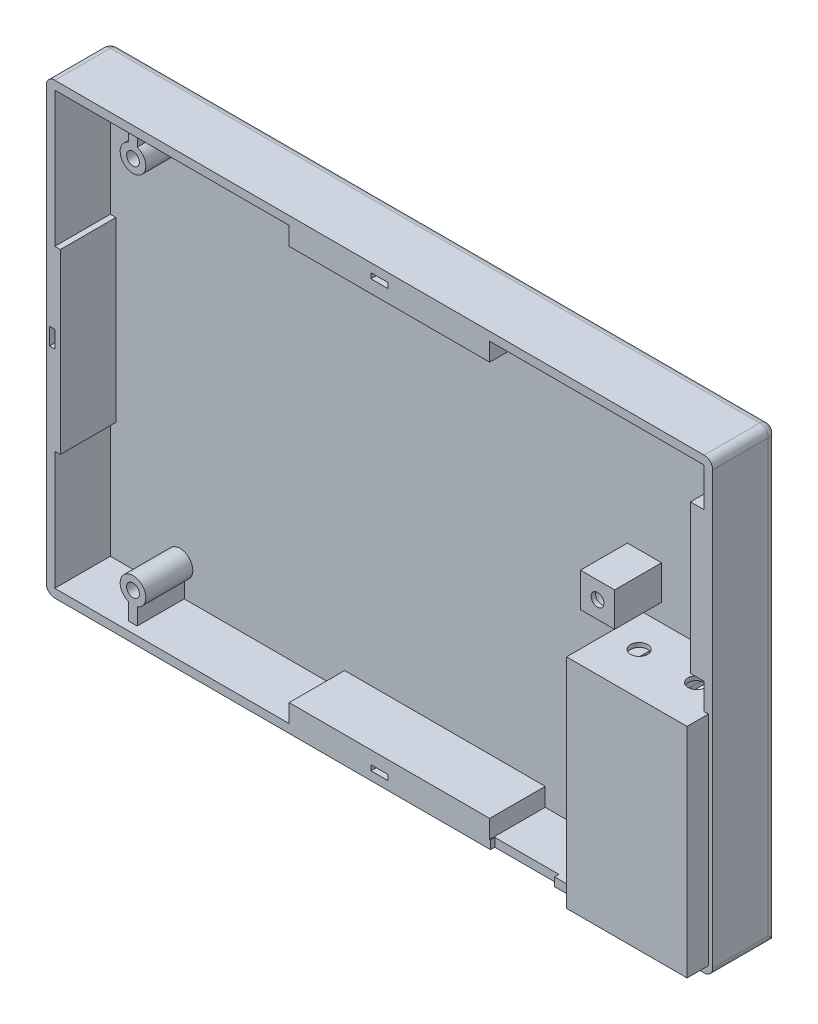
from build123d import *

# Parameters (mm, degrees)
SKETCH2_W                = 156
SKETCH2_H                = 105
BOSS_EXTRUDE1_DEPTH      = 15
SHELL1_T                 = -2
SKETCH16_W               = 1.3
SKETCH16_H               = 41.538446475
BOSS_EXTRUDE7_DEPTH      = 13
SKETCH17_W               = 46.949973518
SKETCH17_H               = 1.75
BOSS_EXTRUDE8_DEPTH      = 13
SKETCH18_W               = 27.2
SKETCH18_H               = 51
BOSS_EXTRUDE9_DEPTH      = 18
SHELL2_START             = 2
SHELL2_DEPTH             = 50
SHELL2_START_2           = 102.25
SHELL2_2_OUTLINE_W       = 44.949973518
SHELL2_2_OUTLINE_H       = 13
SHELL2_2_DEPTH           = 1.75
SHELL2_START_3           = 30.788376177
SHELL2_3_OUTLINE_W       = 1.3
SHELL2_3_OUTLINE_H       = 13
SHELL2_3_DEPTH           = 39.538446475
SHELL2_START_4           = 1
SHELL2_4_OUTLINE_W       = 27.2
SHELL2_4_OUTLINE_H       = 13
SHELL2_4_DEPTH           = 1
SKETCH19_W               = 26.2
SKETCH19_H               = 52
CUT_EXTRUDE9_DEPTH       = 2
BOSS_EXTRUDE10_REACH     = 190.566
SKETCH24_W               = 0.891520296
SKETCH24_H               = 50.929477882
SKETCH25_W               = 26.2
SKETCH25_H               = 1
BOSS_EXTRUDE11_DEPTH     = 12
SKETCH27_W               = 26.2
SKETCH27_H               = 1
BOSS_EXTRUDE12_DEPTH     = 18
SKETCH28_W               = 9
SKETCH28_H               = 1
CUT_EXTRUDE10_DEPTH      = 14
SKETCH29_W               = 7
SKETCH29_H               = 1
CUT_EXTRUDE11_DEPTH      = 13
SKETCH30_W               = 0.5
SKETCH30_H               = 52
CUT_EXTRUDE12_DEPTH      = 1
SKETCH31_W               = 0.5
SKETCH31_H               = 52
CUT_EXTRUDE13_DEPTH      = 1
SKETCH32_W               = 5.2
SKETCH32_H               = 1
BOSS_EXTRUDE13_DEPTH     = 1
SKETCH34_W               = 5.2
SKETCH34_H               = 1
BOSS_EXTRUDE14_DEPTH     = 1
SKETCH35_W               = 5.190628433
SKETCH35_H               = 3.5
BOSS_EXTRUDE15_DEPTH     = 20
SKETCH38_W               = 0.5
SKETCH38_H               = 0.070522118
CUT_EXTRUDE14_DEPTH      = 1
SKETCH41_R               = 2
CUT_EXTRUDE15_DEPTH      = 1
SKETCH42_R               = 2
CUT_EXTRUDE16_DEPTH      = 1
SKETCH43_W               = 5.190628433
SKETCH43_H               = 4.5
CUT_EXTRUDE17_DEPTH      = 1
SKETCH44_W               = 1
SKETCH44_H               = 51.006111213
BOSS_EXTRUDE16_DEPTH     = 5
SKETCH46_W               = 4.2
SKETCH46_H               = 1
CUT_EXTRUDE18_DEPTH      = 4.5
CUT_EXTRUDE19_DEPTH      = 2
CUT_EXTRUDE19_DEPTH_BACK = 2
SKETCH47_W               = 27.2
SKETCH47_H               = 2
SKETCH50_W               = 3.2
SKETCH50_H               = 34.771823391
BOSS_EXTRUDE17_DEPTH     = 13
SKETCH51_R               = 3
BOSS_EXTRUDE18_DEPTH     = 13
SKETCH54_R               = 1.5
CUT_EXTRUDE20_DEPTH      = 6
SKETCH56_W               = 4
SKETCH56_H               = 1.25
CUT_EXTRUDE21_DEPTH      = 3
SKETCH57_W               = 1.25
SKETCH57_H               = 4
CUT_EXTRUDE22_DEPTH      = 3
SKETCH60_W               = 15
SKETCH60_H               = 1
CUT_EXTRUDE24_DEPTH      = 2
SKETCH62_W               = 8
SKETCH62_H               = 8
BOSS_EXTRUDE19_DEPTH     = 13
SKETCH64_R               = 3
CUT_EXTRUDE25_DEPTH      = 12
SKETCH63_R               = 1.5
CUT_EXTRUDE26_DEPTH      = 1
FILLET1_R                = 2
SKETCH66_W               = 46.949973518
SKETCH66_H               = 2.5
BOSS_EXTRUDE20_DEPTH     = 13
RIB1_REACH               = 190.566
SKETCH69_WALLS_W         = 2
SKETCH69_WALLS_H         = 382.881276878
RIB2_REACH               = 190.566
SKETCH70_WALLS_W         = 2
SKETCH70_WALLS_H         = 382.881276878


# Read off the part's stored shape, not the designer's step: Shell2
with BuildPart() as part:
    # Sketch2 → Boss-Extrude1 (new body)
    with BuildSketch(Plane.XY):
        with Locations((78, 52.5)):
            Rectangle(SKETCH2_W, SKETCH2_H)
    extrude(amount=BOSS_EXTRUDE1_DEPTH)

    # Shell1
    shell1_openings = [part.faces().sort_by_distance(p)[0] for p in [
        (78, 52.5, 15),
    ]]
    offset(amount=SHELL1_T, openings=shell1_openings, kind=Kind.INTERSECTION)

    # Sketch16 → Boss-Extrude7 (add)
    with BuildSketch(Plane.XY.offset(2)):
        with Locations((2.65, 50.557599415)):
            Rectangle(SKETCH16_W, SKETCH16_H)
    extrude(amount=BOSS_EXTRUDE7_DEPTH)

    # Sketch17 → Boss-Extrude8 (add)
    with BuildSketch(Plane.XY.offset(2)):
        with Locations((80.323462853, 102.125)):
            Rectangle(SKETCH17_W, SKETCH17_H)
    boss_extrude8 = extrude(amount=BOSS_EXTRUDE8_DEPTH)

    # Sketch18 → Boss-Extrude9 (add)
    with BuildSketch(Plane.XY.offset(2)):
        with Locations((140.4, 27.5)):
            Rectangle(SKETCH18_W, SKETCH18_H)
    extrude(amount=BOSS_EXTRUDE9_DEPTH)

    # Shell2 outline → Shell2 (cut)
    with BuildSketch(Plane(origin=(0, 0, 0), x_dir=(1, 0, 0), z_dir=(0, 1, 0)).offset(SHELL2_START)):
        Polygon((127.8, -1), (127.8, -19), (154, -19), (154, -14), (155, -14), (155, -1), align=None)
    extrude(amount=SHELL2_DEPTH, mode=Mode.SUBTRACT)

    # Shell2 2 outline → Shell2 2 (cut)
    with BuildSketch(Plane(origin=(0, 0, 0), x_dir=(1, 0, 0), z_dir=(0, 1, 0)).offset(SHELL2_START_2)):
        with Locations((80.323462853, -7.5)):
            Rectangle(SHELL2_2_OUTLINE_W, SHELL2_2_OUTLINE_H)
    extrude(amount=SHELL2_2_DEPTH, mode=Mode.SUBTRACT)

    # Shell2 3 outline → Shell2 3 (cut)
    with BuildSketch(Plane(origin=(0, 0, 0), x_dir=(1, 0, 0), z_dir=(0, 1, 0)).offset(SHELL2_START_3)):
        with Locations((1.65, -7.5)):
            Rectangle(SHELL2_3_OUTLINE_W, SHELL2_3_OUTLINE_H)
    extrude(amount=SHELL2_3_DEPTH, mode=Mode.SUBTRACT)

    # Shell2 4 outline → Shell2 4 (cut)
    with BuildSketch(Plane(origin=(0, 0, 0), x_dir=(1, 0, 0), z_dir=(0, 1, 0)).offset(SHELL2_START_4)):
        with Locations((141.4, -7.5)):
            Rectangle(SHELL2_4_OUTLINE_W, SHELL2_4_OUTLINE_H)
    extrude(amount=SHELL2_4_DEPTH, mode=Mode.SUBTRACT)

    # Sketch19 → Cut-Extrude9 (cut)
    with BuildSketch(Plane(origin=(0, 0, 0), x_dir=(-1, 0, 0), z_dir=(0, 0, -1))):
        with Locations((-140.9, 26)):
            Rectangle(SKETCH19_W, SKETCH19_H)
    extrude(amount=-CUT_EXTRUDE9_DEPTH, mode=Mode.SUBTRACT)

    # Sketch24 → Boss-Extrude10 (add, up to next)
    with BuildSketch(Plane(origin=(0, 0, 14), x_dir=(-1, 0, 0), z_dir=(0, 0, -1)), mode=Mode.PRIVATE) as boss_extrude10_sk1:
        with Locations((-154.445760148, 26.464738941)):
            Rectangle(SKETCH24_W, SKETCH24_H)
    boss_extrude10_tool1 = extrude(boss_extrude10_sk1.sketch, amount=BOSS_EXTRUDE10_REACH, mode=Mode.PRIVATE) - part.part
    add(boss_extrude10_tool1.solids().sort_by_distance((154.44576, 26.464739, 14))[0])

    # Sketch25 → Boss-Extrude11 (add)
    with BuildSketch(Plane(origin=(0, 0, 14), x_dir=(-1, 0, 0), z_dir=(0, 0, -1))):
        with Locations((-140.9, 1.5)):
            Rectangle(SKETCH25_W, SKETCH25_H)
    extrude(amount=BOSS_EXTRUDE11_DEPTH)

    # Sketch27 → Boss-Extrude12 (add)
    with BuildSketch(Plane(origin=(0, 0, 19), x_dir=(-1, 0, 0), z_dir=(0, 0, -1))):
        with Locations((-140.9, 48)):
            Rectangle(SKETCH27_W, SKETCH27_H)
    extrude(amount=BOSS_EXTRUDE12_DEPTH)

    # Sketch28 → Cut-Extrude10 (cut)
    with BuildSketch(Plane(origin=(0, 0, 1), x_dir=(-1, 0, 0), z_dir=(0, 0, -1))):
        with Locations((-147.5, 48)):
            Rectangle(SKETCH28_W, SKETCH28_H)
    extrude(amount=-CUT_EXTRUDE10_DEPTH, mode=Mode.SUBTRACT)

    # Sketch29 → Cut-Extrude11 (cut)
    with BuildSketch(Plane(origin=(0, 0, 1), x_dir=(-1, 0, 0), z_dir=(0, 0, -1))):
        with Locations((-134.3, 48)):
            Rectangle(SKETCH29_W, SKETCH29_H)
    extrude(amount=-CUT_EXTRUDE11_DEPTH, mode=Mode.SUBTRACT)

    # Sketch30 → Cut-Extrude12 (cut)
    with BuildSketch(Plane(origin=(0, 0, 0), x_dir=(-1, 0, 0), z_dir=(0, 0, -1))):
        with Locations((-127.55, 26)):
            Rectangle(SKETCH30_W, SKETCH30_H)
    extrude(amount=-CUT_EXTRUDE12_DEPTH, mode=Mode.SUBTRACT)

    # Sketch31 → Cut-Extrude13 (cut)
    with BuildSketch(Plane(origin=(0, 0, 0), x_dir=(-1, 0, 0), z_dir=(0, 0, -1))):
        with Locations((-154.25, 26)):
            Rectangle(SKETCH31_W, SKETCH31_H)
    extrude(amount=-CUT_EXTRUDE13_DEPTH, mode=Mode.SUBTRACT)

    # Sketch32 → Boss-Extrude13 (add)
    with BuildSketch(Plane(origin=(0, 0, 1), x_dir=(-1, 0, 0), z_dir=(0, 0, -1))):
        with Locations((-140.4, 48)):
            Rectangle(SKETCH32_W, SKETCH32_H)
    extrude(amount=BOSS_EXTRUDE13_DEPTH)

    # Sketch34 → Boss-Extrude14 (add)
    with BuildSketch(Plane(origin=(0, 0, 0), x_dir=(-1, 0, 0), z_dir=(0, 0, -1))):
        with Locations((-140.4, 48)):
            Rectangle(SKETCH34_W, SKETCH34_H)
    extrude(amount=BOSS_EXTRUDE14_DEPTH)

    # Sketch35 → Boss-Extrude15 (add)
    with BuildSketch(Plane(origin=(0, 0, 19), x_dir=(-1, 0, 0), z_dir=(0, 0, -1))):
        with Locations((-140.395314217, 50.25)):
            Rectangle(SKETCH35_W, SKETCH35_H)
    extrude(amount=BOSS_EXTRUDE15_DEPTH)

    # Sketch38 → Cut-Extrude14 (cut)
    with BuildSketch(Plane(origin=(0, 0, 14), x_dir=(-1, 0, 0), z_dir=(0, 0, -1))):
        with Locations((-154.25, 51.964738941)):
            Rectangle(SKETCH38_W, SKETCH38_H)
    extrude(amount=-CUT_EXTRUDE14_DEPTH, mode=Mode.SUBTRACT)

    # Sketch41 → Cut-Extrude15 (cut)
    with BuildSketch(Plane.XZ.offset(-52)):
        with Locations(Location((147.249273033, 10, 0), (0, 0, 270))):
            Circle(SKETCH41_R)
    extrude(amount=-CUT_EXTRUDE15_DEPTH, mode=Mode.SUBTRACT)

    # Sketch42 → Cut-Extrude16 (cut)
    with BuildSketch(Plane.XZ.offset(-52)):
        with Locations(Location((133.793210636, 10, 0), (0, 0, 270))):
            Circle(SKETCH42_R)
    extrude(amount=-CUT_EXTRUDE16_DEPTH, mode=Mode.SUBTRACT)

    # Sketch43 → Cut-Extrude17 (cut)
    with BuildSketch(Plane(origin=(0, 0, -1), x_dir=(-1, 0, 0), z_dir=(0, 0, -1))):
        with Locations((-140.395314217, 49.75)):
            Rectangle(SKETCH43_W, SKETCH43_H)
    extrude(amount=-CUT_EXTRUDE17_DEPTH, mode=Mode.SUBTRACT)

    # Sketch44 → Boss-Extrude16 (add)
    with BuildSketch(Plane.XY.offset(15)):
        with Locations((154.5, 27.496944394)):
            Rectangle(SKETCH44_W, SKETCH44_H)
    extrude(amount=BOSS_EXTRUDE16_DEPTH)

    # Sketch46 → Cut-Extrude18 (cut)
    with BuildSketch(Plane.XZ.offset(-47.5)):
        with Locations((140.4, 1.5)):
            Rectangle(SKETCH46_W, SKETCH46_H)
    extrude(amount=-CUT_EXTRUDE18_DEPTH, mode=Mode.SUBTRACT)

    # Sketch47 → Cut-Extrude19 (cut, two sides: drawn at the far end of the back side and taken through both)
    with BuildSketch(Plane(origin=(0, 0, 2), x_dir=(-1, 0, 0), z_dir=(0, 0, -1)).offset(-CUT_EXTRUDE19_DEPTH_BACK)):
        with Locations((-140.9, 1)):
            Rectangle(SKETCH47_W, SKETCH47_H)
    extrude(amount=CUT_EXTRUDE19_DEPTH + CUT_EXTRUDE19_DEPTH_BACK, mode=Mode.SUBTRACT)

    # Mirror3: Boss-Extrude8 across plane
    add(boss_extrude8.mirror(Plane(origin=(0, 52.5, 0), x_dir=(0, 0, 1), z_dir=(0, -1, 0))))

    # Sketch50 → Boss-Extrude17 (add)
    with BuildSketch(Plane.XY.offset(2)):
        with Locations((152.4, 76.53582262)):
            Rectangle(SKETCH50_W, SKETCH50_H)
    extrude(amount=BOSS_EXTRUDE17_DEPTH)

    # Sketch51 → Boss-Extrude18 (add)
    with BuildSketch(Plane.XY):
        with Locations(Location((18.3, 96.25, 0), (0, 0, 180))):
            Circle(SKETCH51_R)
    boss_extrude18 = extrude(amount=BOSS_EXTRUDE18_DEPTH)

    # Sketch54 → Cut-Extrude20 (cut)
    with BuildSketch(Plane.XY.offset(13)):
        with Locations((18.3, 96.25)):
            Circle(SKETCH54_R)
    cut_extrude20 = extrude(amount=-CUT_EXTRUDE20_DEPTH, mode=Mode.SUBTRACT)

    # Mirror4: Boss-Extrude18, Cut-Extrude20 across plane
    add(boss_extrude18.mirror(Plane(origin=(0, 52.5, 0), x_dir=(0, 0, 1), z_dir=(0, -1, 0))))
    add(cut_extrude20.mirror(Plane(origin=(0, 52.5, 0), x_dir=(0, 0, 1), z_dir=(0, -1, 0))), mode=Mode.SUBTRACT)

    # Sketch56 → Cut-Extrude21 (cut)
    with BuildSketch(Plane.XY.offset(15)):
        with Locations((78, 102.375)):
            Rectangle(SKETCH56_W, SKETCH56_H)
    cut_extrude21 = extrude(amount=-CUT_EXTRUDE21_DEPTH, mode=Mode.SUBTRACT)

    # Mirror5: Cut-Extrude21 across plane
    add(cut_extrude21.mirror(Plane(origin=(0, 52.5, 0), x_dir=(0, 0, 1), z_dir=(0, -1, 0))), mode=Mode.SUBTRACT)

    # Sketch57 → Cut-Extrude22 (cut)
    with BuildSketch(Plane.XY.offset(15)):
        with Locations((1.375, 52.5)):
            Rectangle(SKETCH57_W, SKETCH57_H)
    extrude(amount=-CUT_EXTRUDE22_DEPTH, mode=Mode.SUBTRACT)

    # Sketch60 → Cut-Extrude24 (cut)
    with BuildSketch(Plane.XZ):
        with Locations((111.5, 14.5)):
            Rectangle(SKETCH60_W, SKETCH60_H)
    extrude(amount=-CUT_EXTRUDE24_DEPTH, mode=Mode.SUBTRACT)

    # Sketch62 → Boss-Extrude19 (add)
    with BuildSketch(Plane(origin=(0, 0, 0), x_dir=(-1, 0, 0), z_dir=(0, 0, -1))):
        with Locations((-127.05, 61.2)):
            Rectangle(SKETCH62_W, SKETCH62_H)
    extrude(amount=-BOSS_EXTRUDE19_DEPTH)

    # Sketch64 → Cut-Extrude25 (cut)
    with BuildSketch(Plane(origin=(0, 0, 0), x_dir=(-1, 0, 0), z_dir=(0, 0, -1))):
        with Locations((-127.05, 61.2)):
            Circle(SKETCH64_R)
    extrude(amount=-CUT_EXTRUDE25_DEPTH, mode=Mode.SUBTRACT)

    # Sketch63 → Cut-Extrude26 (cut)
    with BuildSketch(Plane.XY.offset(13)):
        with Locations((127.05, 61.2)):
            Circle(SKETCH63_R)
    extrude(amount=-CUT_EXTRUDE26_DEPTH, mode=Mode.SUBTRACT)

    # Fillet1
    # the kernel refuses this fillet: 2 mm, written as the material it takes off along each edge
    with BuildSketch(Plane(origin=(2, 2, 2), x_dir=(0, 0, -1), z_dir=(0, -1, 0))) as fillet1_piece_1_section:
        Polygon((0, 0), (FILLET1_R, 0), (FILLET1_R, -FILLET1_R), (0, -FILLET1_R), align=None)
    fillet1_piece_1 = extrude(amount=FILLET1_R, mode=Mode.PRIVATE)
    fillet1_piece_1 = fillet1_piece_1 - Plane(origin=(2, 2, 2), x_dir=(0.7071067811865475, 0, 0.7071067811865475), z_dir=(0, -1, 0)) * Sphere(FILLET1_R, mode=Mode.PRIVATE)
    add(fillet1_piece_1, mode=Mode.SUBTRACT)
    with BuildSketch(Plane(origin=(2, 103, 2), x_dir=(-1, 0, 0), z_dir=(0, 0, -1))) as fillet1_piece_2_section:
        Polygon((0, 0), (FILLET1_R, 0), (FILLET1_R, FILLET1_R), (0, FILLET1_R), align=None)
    fillet1_piece_2 = extrude(amount=FILLET1_R, mode=Mode.PRIVATE)
    fillet1_piece_2 = fillet1_piece_2 - Plane(origin=(2, 103, 2), x_dir=(0.7071067811865475, -0.7071067811865475, 0), z_dir=(0, 0, -1)) * Sphere(FILLET1_R, mode=Mode.PRIVATE)
    add(fillet1_piece_2, mode=Mode.SUBTRACT)
    with BuildSketch(Plane(origin=(154, 103, 2), x_dir=(0, 1, 0), z_dir=(0, 0, -1))) as fillet1_piece_3_section:
        Polygon((0, 0), (FILLET1_R, 0), (FILLET1_R, FILLET1_R), (0, FILLET1_R), align=None)
    fillet1_piece_3 = extrude(amount=FILLET1_R, mode=Mode.PRIVATE)
    fillet1_piece_3 = fillet1_piece_3 - Plane(origin=(154, 103, 2), x_dir=(-0.7071067811865475, -0.7071067811865475, 0), z_dir=(0, 0, -1)) * Sphere(FILLET1_R, mode=Mode.PRIVATE)
    add(fillet1_piece_3, mode=Mode.SUBTRACT)
    with BuildSketch(Plane(origin=(0, 0, 2), x_dir=(1, 0, 0), z_dir=(0, 0, 1)), Plane(origin=(0, 105, 2), x_dir=(0, -1, 0), z_dir=(0, 0, 1))) as fillet1_piece_4:
        with BuildLine():
            CenterArc((FILLET1_R, FILLET1_R), FILLET1_R, 180, 90)
            Line((0, FILLET1_R), (0, 0))
            Line((0, 0), (FILLET1_R, 0))
        make_face()
    extrude(amount=18, mode=Mode.SUBTRACT)
    with BuildSketch(Plane(origin=(156, 0, -5), x_dir=(-1, 0, 0), z_dir=(0, 0, 1))) as fillet1_piece_5:
        with BuildLine():
            CenterArc((FILLET1_R, -FILLET1_R), FILLET1_R, 90, 90)
            Line((0, -FILLET1_R), (0, 0))
            Line((0, 0), (FILLET1_R, 0))
        make_face()
    extrude(amount=25, mode=Mode.SUBTRACT)
    with BuildSketch(Plane(origin=(0, 103, 0), x_dir=(1, 0, 0), z_dir=(0, -1, 0))) as fillet1_piece_6:
        with BuildLine():
            CenterArc((FILLET1_R, FILLET1_R), FILLET1_R, 180, 90)
            Line((0, FILLET1_R), (0, 0))
            Line((0, 0), (FILLET1_R, 0))
        make_face()
    extrude(amount=101, mode=Mode.SUBTRACT)
    with BuildSketch(Plane(origin=(2, 0, 0), x_dir=(0, 0, 1), z_dir=(1, 0, 0))) as fillet1_piece_7:
        with BuildLine():
            CenterArc((FILLET1_R, -FILLET1_R), FILLET1_R, 90, 90)
            Line((0, -FILLET1_R), (0, 0))
            Line((0, 0), (FILLET1_R, 0))
        make_face()
    extrude(amount=130.3, mode=Mode.SUBTRACT)
    with BuildSketch(Plane(origin=(156, -5, 0), x_dir=(-1, 0, 0), z_dir=(0, 1, 0))) as fillet1_piece_8:
        with BuildLine():
            CenterArc((FILLET1_R, FILLET1_R), FILLET1_R, 180, 90)
            Line((0, FILLET1_R), (0, 0))
            Line((0, 0), (FILLET1_R, 0))
        make_face()
    extrude(amount=108, mode=Mode.SUBTRACT)
    with BuildSketch(Plane(origin=(156, 105, 2), x_dir=(0, -1, 0), z_dir=(0, 0, 1))) as fillet1_piece_9:
        with BuildLine():
            CenterArc((FILLET1_R, -FILLET1_R), FILLET1_R, 90, 90)
            Line((0, -FILLET1_R), (0, 0))
            Line((0, 0), (FILLET1_R, 0))
        make_face()
    extrude(amount=18, mode=Mode.SUBTRACT)
    with BuildSketch(Plane(origin=(154, 105, 0), x_dir=(0, -1, 0), z_dir=(-1, 0, 0))) as fillet1_piece_10:
        with BuildLine():
            CenterArc((FILLET1_R, FILLET1_R), FILLET1_R, 180, 90)
            Line((0, FILLET1_R), (0, 0))
            Line((0, 0), (FILLET1_R, 0))
        make_face()
    extrude(amount=152, mode=Mode.SUBTRACT)

    # Sketch66 → Boss-Extrude20 (add)
    with BuildSketch(Plane.XY.offset(2)):
        with Locations((80.323462853, 100)):
            Rectangle(SKETCH66_W, SKETCH66_H)
    boss_extrude20 = extrude(amount=BOSS_EXTRUDE20_DEPTH)

    # Mirror6: Boss-Extrude20 across plane
    add(boss_extrude20.mirror(Plane(origin=(0, 52.5, 0), x_dir=(0, 0, 1), z_dir=(0, -1, 0))))

    # Sketch69 walls → Rib1 (add, up to next)
    with BuildSketch(Plane.XY.offset(13), mode=Mode.PRIVATE) as rib1_sk1:
        with Locations((18.3, 101.125)):
            Rectangle(SKETCH69_WALLS_W, SKETCH69_WALLS_H)
    rib1_tool1 = extrude(rib1_sk1.sketch, amount=-RIB1_REACH, mode=Mode.PRIVATE) - part.part
    add(rib1_tool1.solids().sort_by_distance((18.3, 101.125, 13))[0])

    # Sketch70 walls → Rib2 (add, up to next)
    with BuildSketch(Plane.XY.offset(13), mode=Mode.PRIVATE) as rib2_sk1:
        with Locations((18.3, 3.875)):
            Rectangle(SKETCH70_WALLS_W, SKETCH70_WALLS_H)
    rib2_tool1 = extrude(rib2_sk1.sketch, amount=-RIB2_REACH, mode=Mode.PRIVATE) - part.part
    add(rib2_tool1.solids().sort_by_distance((18.3, 3.875, 13))[0])


solid = part.part
